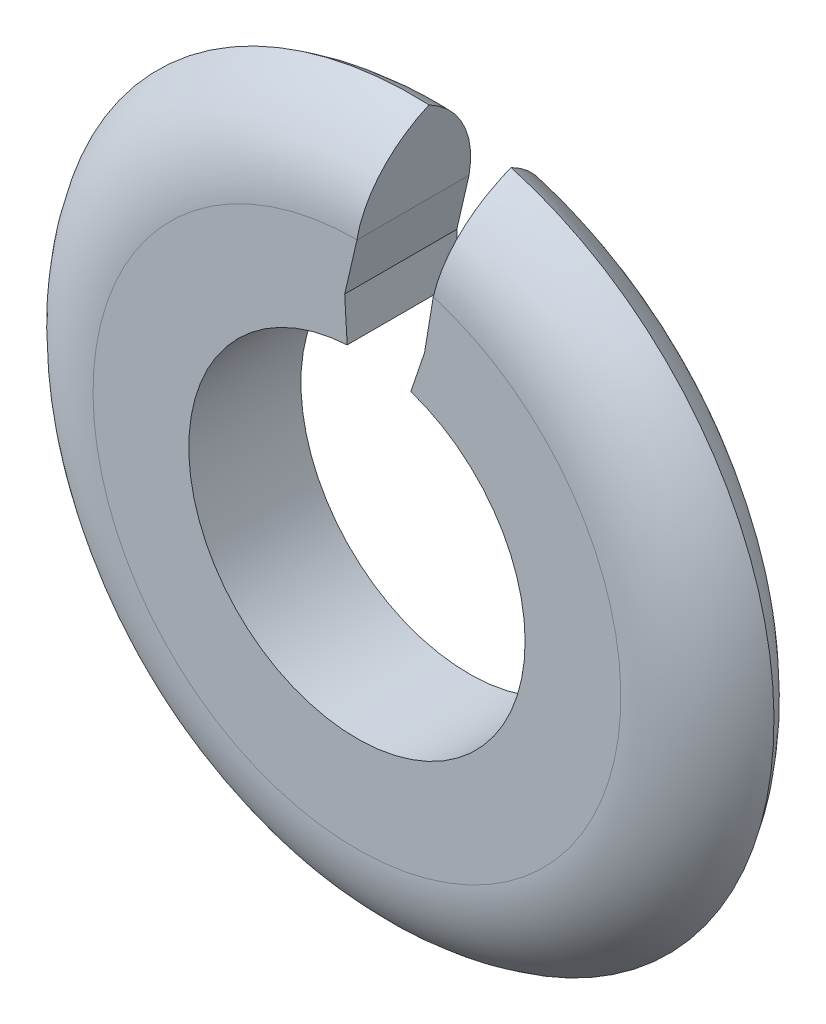
from build123d import *

# Parameters (mm, degrees)
EXTRUDE_1_DEPTH = 1
FILLET_4_R      = 1


with BuildPart() as part:
    # Эскиз1 → Бобышка-Вытянуть1 (new body)
    with BuildSketch(Plane.XY):
        with BuildLine():
            ThreePointArc((0.480680501, 1.420896286), (-0.200493603, -1.486540385), (-0.087072694, 1.497470649))
            Line((-0.087072694, 1.497470649), (-0.109259646, 1.879040442))
            Line((-0.109259646, 1.879040442), (0, 2.351791755))
            Line((0, 2.351791755), (0.164870261, 3.350081286))
            ThreePointArc((0.164870261, 3.350081286), (-2.42932337, -2.312707243), (3.35413578, 0))
            ThreePointArc((3.35413578, 0), (2.672755085, 2.02647652), (0.905453106, 3.229610116))
            Line((0.905453106, 3.229610116), (0.680492814, 2.251189461))
            Line((0.680492814, 2.251189461), (0.603162473, 1.782954201))
            Line((0.603162473, 1.782954201), (0.480680501, 1.420896286))
        make_face()
    extrude(amount=EXTRUDE_1_DEPTH)

    # Скругление4
    # the kernel refuses this fillet: 1 mm, written as the material it takes off along each edge
    with BuildSketch(Plane(origin=(0, 0, 0), x_dir=(0.7154585418430487, 0.6986551902790236, 0), z_dir=(0.6986551902790236, -0.7154585418430487, 0))) as fillet_4_piece_1:
        with BuildLine():
            CenterArc((3.35413578 - FILLET_4_R, FILLET_4_R), FILLET_4_R, 270, 90)
            Line((3.35413578 - FILLET_4_R, 0), (3.35413578, 0))
            Line((3.35413578, 0), (3.35413578, FILLET_4_R))
        make_face()
    revolve(axis=Axis((0, 0, 0), (0, 0, 1)), revolution_arc=315.68079094, mode=Mode.SUBTRACT)
    with BuildSketch(Plane(origin=(0, 0, 1), x_dir=(0.7154585418430487, 0.6986551902790236, 0), z_dir=(0.6986551902790236, -0.7154585418430487, 0))) as fillet_4_piece_2:
        with BuildLine():
            CenterArc((3.35413578 - FILLET_4_R, -FILLET_4_R), FILLET_4_R, 0, 90)
            Line((3.35413578 - FILLET_4_R, 0), (3.35413578, 0))
            Line((3.35413578, 0), (3.35413578, -FILLET_4_R))
        make_face()
    revolve(axis=Axis((0, 0, 1), (0, 0, 1)), revolution_arc=315.68079094, mode=Mode.SUBTRACT)
    with BuildSketch(Plane(origin=(0, 0, 1), x_dir=(1, 0, 0), z_dir=(0, -1, 0))) as fillet_4_piece_3:
        with BuildLine():
            CenterArc((3.35413578 - FILLET_4_R, -FILLET_4_R), FILLET_4_R, 0, 90)
            Line((3.35413578 - FILLET_4_R, 0), (3.35413578, 0))
            Line((3.35413578, 0), (3.35413578, -FILLET_4_R))
        make_face()
    revolve(axis=Axis((0, 0, 1), (0, 0, 1)), revolution_arc=117.055659858, mode=Mode.SUBTRACT)
    with BuildSketch(Plane(origin=(0, 0, 0), x_dir=(1, 0, 0), z_dir=(0, -1, 0))) as fillet_4_piece_4:
        with BuildLine():
            CenterArc((3.35413578 - FILLET_4_R, FILLET_4_R), FILLET_4_R, 270, 90)
            Line((3.35413578 - FILLET_4_R, 0), (3.35413578, 0))
            Line((3.35413578, 0), (3.35413578, FILLET_4_R))
        make_face()
    revolve(axis=Axis((0, 0, 0), (0, 0, 1)), revolution_arc=117.055659858, mode=Mode.SUBTRACT)


solid = part.part
